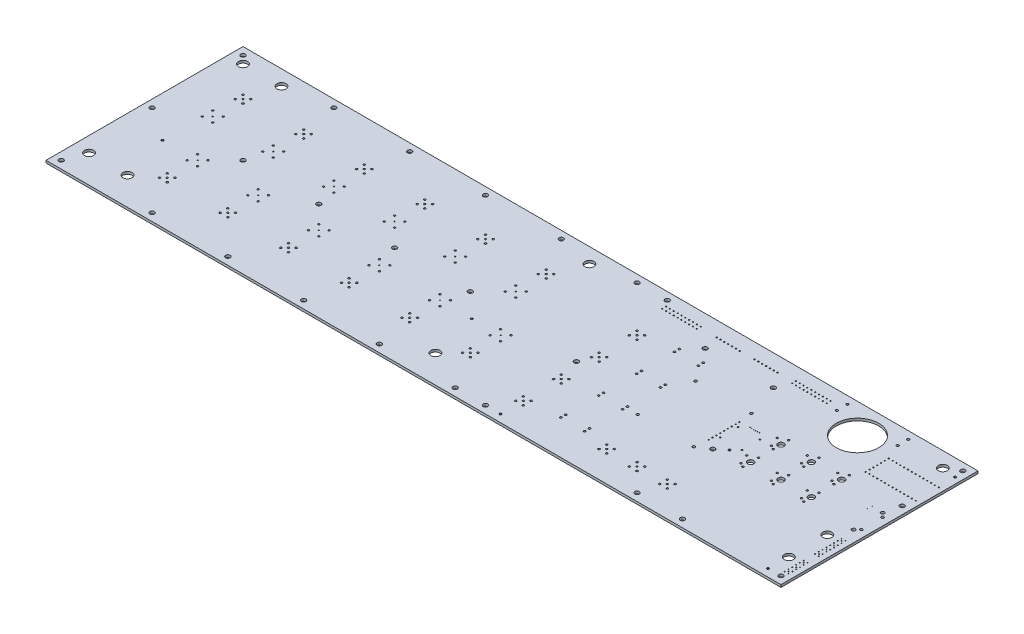
from build123d import *

# Parameters (mm, degrees)
SKETCH3_W           = 485
SKETCH3_H           = 130
SKETCH3_R           = 14
SKETCH3_R_2         = 1.5
SKETCH3_R_3         = 3
SKETCH3_R_4         = 0.3
SKETCH3_R_5         = 0.59055
SKETCH3_R_6         = 0.638175
SKETCH3_R_7         = 0.3375
SKETCH3_R_8         = 0.6
SKETCH3_R_9         = 0.8
SKETCH3_R_10        = 0.9
SKETCH3_R_11        = 1.15
SKETCH3_R_12        = 0.69375
SKETCH3_R_13        = 2.0002
SKETCH3_R_14        = 0.6429
SKETCH3_R_15        = 0.635
SKETCH3_R_16        = 0.225
SKETCH3_R_17        = 0.45
SKETCH3_R_18        = 0.36195
SKETCH3_R_19        = 0.381
SKETCH3_R_20        = 0.879
BOSS_EXTRUDE1_DEPTH = 1.6


with BuildPart() as part:
    # Sketch3 → Boss-Extrude1 (new body)
    with BuildSketch(Plane(origin=(0, 0, 0), x_dir=(1, 0, 0), z_dir=(0, 1, 0))):
        with Locations((62.5, 5)):
            Rectangle(SKETCH3_W, SKETCH3_H)
        with Locations((245, 50.5)):
            Circle(SKETCH3_R, mode=Mode.SUBTRACT)
        with Locations((-175, 65)):
            Circle(SKETCH3_R_2, mode=Mode.SUBTRACT)
        with Locations((-175, -55)):
            Circle(SKETCH3_R_2, mode=Mode.SUBTRACT)
        with Locations((300, 65)):
            Circle(SKETCH3_R_2, mode=Mode.SUBTRACT)
        with Locations((300, -55)):
            Circle(SKETCH3_R_2, mode=Mode.SUBTRACT)
        with Locations((85, 65)):
            Circle(SKETCH3_R_2, mode=Mode.SUBTRACT)
        with Locations((105, 65)):
            Circle(SKETCH3_R_2, mode=Mode.SUBTRACT)
        with Locations((105, -55)):
            Circle(SKETCH3_R_2, mode=Mode.SUBTRACT)
        with Locations((85, -55)):
            Circle(SKETCH3_R_2, mode=Mode.SUBTRACT)
        with Locations((35, -55)):
            Circle(SKETCH3_R_2, mode=Mode.SUBTRACT)
        with Locations((-15, -55)):
            Circle(SKETCH3_R_2, mode=Mode.SUBTRACT)
        with Locations((-65, -55)):
            Circle(SKETCH3_R_2, mode=Mode.SUBTRACT)
        with Locations((-115, -55)):
            Circle(SKETCH3_R_2, mode=Mode.SUBTRACT)
        with Locations((-115, 65)):
            Circle(SKETCH3_R_2, mode=Mode.SUBTRACT)
        with Locations((-65, 65)):
            Circle(SKETCH3_R_2, mode=Mode.SUBTRACT)
        with Locations((-15, 65)):
            Circle(SKETCH3_R_2, mode=Mode.SUBTRACT)
        with Locations((35, 65)):
            Circle(SKETCH3_R_2, mode=Mode.SUBTRACT)
        with Locations((-115, 5)):
            Circle(SKETCH3_R_2, mode=Mode.SUBTRACT)
        with Locations((-65, 5)):
            Circle(SKETCH3_R_2, mode=Mode.SUBTRACT)
        with Locations((-15, 5)):
            Circle(SKETCH3_R_2, mode=Mode.SUBTRACT)
        with Locations((35, 5)):
            Circle(SKETCH3_R_2, mode=Mode.SUBTRACT)
        with Locations((-175, 5)):
            Circle(SKETCH3_R_2, mode=Mode.SUBTRACT)
        with Locations((300, 25)):
            Circle(SKETCH3_R_2, mode=Mode.SUBTRACT)
        with Locations((110, 0)):
            Circle(SKETCH3_R_2, mode=Mode.SUBTRACT)
        with Locations((-170, 60)):
            Circle(SKETCH3_R_3, mode=Mode.SUBTRACT)
        with Locations((58.6, 60)):
            Circle(SKETCH3_R_3, mode=Mode.SUBTRACT)
        with Locations((58.6, -41.6)):
            Circle(SKETCH3_R_3, mode=Mode.SUBTRACT)
        with Locations((-170, -41.6)):
            Circle(SKETCH3_R_3, mode=Mode.SUBTRACT)
        with Locations((291.8, -41.6)):
            Circle(SKETCH3_R_3, mode=Mode.SUBTRACT)
        with Locations((-144.6, 60)):
            Circle(SKETCH3_R_3, mode=Mode.SUBTRACT)
        with Locations((-144.6, -41.6)):
            Circle(SKETCH3_R_3, mode=Mode.SUBTRACT)
        with Locations((291.8, -16.2)):
            Circle(SKETCH3_R_3, mode=Mode.SUBTRACT)
        with Locations((291.8, 60)):
            Circle(SKETCH3_R_3, mode=Mode.SUBTRACT)
        with Locations((145, 50)):
            Circle(SKETCH3_R_2, mode=Mode.SUBTRACT)
        with Locations((205, -55)):
            Circle(SKETCH3_R_2, mode=Mode.SUBTRACT)
        with Locations((190, 50)):
            Circle(SKETCH3_R_2, mode=Mode.SUBTRACT)
        with Locations((235, -55)):
            Circle(SKETCH3_R_2, mode=Mode.SUBTRACT)
        with Locations((205, -5)):
            Circle(SKETCH3_R_2, mode=Mode.SUBTRACT)
        with Locations((298.73, -38.73)):
            Circle(SKETCH3_R_4, mode=Mode.SUBTRACT)
        with Locations((298.73, -41.27)):
            Circle(SKETCH3_R_4, mode=Mode.SUBTRACT)
        with Locations((301.27, -41.27)):
            Circle(SKETCH3_R_4, mode=Mode.SUBTRACT)
        with Locations((301.27, -38.73)):
            Circle(SKETCH3_R_4, mode=Mode.SUBTRACT)
        with Locations((300, -40)):
            Circle(SKETCH3_R_4, mode=Mode.SUBTRACT)
        with Locations((210, -40)):
            Circle(SKETCH3_R_5, mode=Mode.SUBTRACT)
        with Locations((207.46, -37.46)):
            Circle(SKETCH3_R_6, mode=Mode.SUBTRACT)
        with Locations((212.54, -37.46)):
            Circle(SKETCH3_R_6, mode=Mode.SUBTRACT)
        with Locations((207.46, -42.54)):
            Circle(SKETCH3_R_6, mode=Mode.SUBTRACT)
        with Locations((212.54, -42.54)):
            Circle(SKETCH3_R_6, mode=Mode.SUBTRACT)
        with Locations((298.73, -43.73)):
            Circle(SKETCH3_R_4, mode=Mode.SUBTRACT)
        with Locations((298.73, -46.27)):
            Circle(SKETCH3_R_4, mode=Mode.SUBTRACT)
        with Locations((301.27, -46.27)):
            Circle(SKETCH3_R_4, mode=Mode.SUBTRACT)
        with Locations((301.27, -43.73)):
            Circle(SKETCH3_R_4, mode=Mode.SUBTRACT)
        with Locations((300, -45)):
            Circle(SKETCH3_R_4, mode=Mode.SUBTRACT)
        with Locations((190, -40)):
            Circle(SKETCH3_R_5, mode=Mode.SUBTRACT)
        with Locations((187.46, -37.46)):
            Circle(SKETCH3_R_6, mode=Mode.SUBTRACT)
        with Locations((192.54, -37.46)):
            Circle(SKETCH3_R_6, mode=Mode.SUBTRACT)
        with Locations((187.46, -42.54)):
            Circle(SKETCH3_R_6, mode=Mode.SUBTRACT)
        with Locations((192.54, -42.54)):
            Circle(SKETCH3_R_6, mode=Mode.SUBTRACT)
        with Locations((115, -40)):
            Circle(SKETCH3_R_5, mode=Mode.SUBTRACT)
        with Locations((112.46, -37.46)):
            Circle(SKETCH3_R_6, mode=Mode.SUBTRACT)
        with Locations((117.54, -37.46)):
            Circle(SKETCH3_R_6, mode=Mode.SUBTRACT)
        with Locations((112.46, -42.54)):
            Circle(SKETCH3_R_6, mode=Mode.SUBTRACT)
        with Locations((117.54, -42.54)):
            Circle(SKETCH3_R_6, mode=Mode.SUBTRACT)
        with Locations((115, -15)):
            Circle(SKETCH3_R_5, mode=Mode.SUBTRACT)
        with Locations((112.46, -12.46)):
            Circle(SKETCH3_R_6, mode=Mode.SUBTRACT)
        with Locations((117.54, -12.46)):
            Circle(SKETCH3_R_6, mode=Mode.SUBTRACT)
        with Locations((112.46, -17.54)):
            Circle(SKETCH3_R_6, mode=Mode.SUBTRACT)
        with Locations((117.54, -17.54)):
            Circle(SKETCH3_R_6, mode=Mode.SUBTRACT)
        with Locations((115, 10)):
            Circle(SKETCH3_R_5, mode=Mode.SUBTRACT)
        with Locations((112.46, 12.54)):
            Circle(SKETCH3_R_6, mode=Mode.SUBTRACT)
        with Locations((117.54, 12.54)):
            Circle(SKETCH3_R_6, mode=Mode.SUBTRACT)
        with Locations((112.46, 7.46)):
            Circle(SKETCH3_R_6, mode=Mode.SUBTRACT)
        with Locations((117.54, 7.46)):
            Circle(SKETCH3_R_6, mode=Mode.SUBTRACT)
        with Locations((115, 35)):
            Circle(SKETCH3_R_5, mode=Mode.SUBTRACT)
        with Locations((112.46, 37.54)):
            Circle(SKETCH3_R_6, mode=Mode.SUBTRACT)
        with Locations((117.54, 37.54)):
            Circle(SKETCH3_R_6, mode=Mode.SUBTRACT)
        with Locations((112.46, 32.46)):
            Circle(SKETCH3_R_6, mode=Mode.SUBTRACT)
        with Locations((117.54, 32.46)):
            Circle(SKETCH3_R_6, mode=Mode.SUBTRACT)
        with Locations((298.73, -28.73)):
            Circle(SKETCH3_R_4, mode=Mode.SUBTRACT)
        with Locations((298.73, -31.27)):
            Circle(SKETCH3_R_4, mode=Mode.SUBTRACT)
        with Locations((301.27, -31.27)):
            Circle(SKETCH3_R_4, mode=Mode.SUBTRACT)
        with Locations((301.27, -28.73)):
            Circle(SKETCH3_R_4, mode=Mode.SUBTRACT)
        with Locations((300, -30)):
            Circle(SKETCH3_R_4, mode=Mode.SUBTRACT)
        with Locations((298.73, -23.73)):
            Circle(SKETCH3_R_4, mode=Mode.SUBTRACT)
        with Locations((298.73, -26.27)):
            Circle(SKETCH3_R_4, mode=Mode.SUBTRACT)
        with Locations((301.27, -26.27)):
            Circle(SKETCH3_R_4, mode=Mode.SUBTRACT)
        with Locations((301.27, -23.73)):
            Circle(SKETCH3_R_4, mode=Mode.SUBTRACT)
        with Locations((300, -25)):
            Circle(SKETCH3_R_4, mode=Mode.SUBTRACT)
        with Locations((298.73, -18.73)):
            Circle(SKETCH3_R_4, mode=Mode.SUBTRACT)
        with Locations((298.73, -21.27)):
            Circle(SKETCH3_R_4, mode=Mode.SUBTRACT)
        with Locations((301.27, -21.27)):
            Circle(SKETCH3_R_4, mode=Mode.SUBTRACT)
        with Locations((301.27, -18.73)):
            Circle(SKETCH3_R_4, mode=Mode.SUBTRACT)
        with Locations((300, -20)):
            Circle(SKETCH3_R_4, mode=Mode.SUBTRACT)
        with Locations((298.73, -13.73)):
            Circle(SKETCH3_R_4, mode=Mode.SUBTRACT)
        with Locations((298.73, -16.27)):
            Circle(SKETCH3_R_4, mode=Mode.SUBTRACT)
        with Locations((301.27, -16.27)):
            Circle(SKETCH3_R_4, mode=Mode.SUBTRACT)
        with Locations((301.27, -13.73)):
            Circle(SKETCH3_R_4, mode=Mode.SUBTRACT)
        with Locations((300, -15)):
            Circle(SKETCH3_R_4, mode=Mode.SUBTRACT)
        with Locations((298.73, -48.73)):
            Circle(SKETCH3_R_4, mode=Mode.SUBTRACT)
        with Locations((298.73, -51.27)):
            Circle(SKETCH3_R_4, mode=Mode.SUBTRACT)
        with Locations((301.27, -51.27)):
            Circle(SKETCH3_R_4, mode=Mode.SUBTRACT)
        with Locations((301.27, -48.73)):
            Circle(SKETCH3_R_4, mode=Mode.SUBTRACT)
        with Locations((300, -50)):
            Circle(SKETCH3_R_4, mode=Mode.SUBTRACT)
        with Locations((170, -40)):
            Circle(SKETCH3_R_5, mode=Mode.SUBTRACT)
        with Locations((167.46, -37.46)):
            Circle(SKETCH3_R_6, mode=Mode.SUBTRACT)
        with Locations((172.54, -37.46)):
            Circle(SKETCH3_R_6, mode=Mode.SUBTRACT)
        with Locations((167.46, -42.54)):
            Circle(SKETCH3_R_6, mode=Mode.SUBTRACT)
        with Locations((172.54, -42.54)):
            Circle(SKETCH3_R_6, mode=Mode.SUBTRACT)
        with Locations((-150, 20)):
            Circle(SKETCH3_R_7, mode=Mode.SUBTRACT)
        with Locations((-146.57, 23.43)):
            Circle(SKETCH3_R_8, mode=Mode.SUBTRACT)
        with Locations((-153.43, 23.43)):
            Circle(SKETCH3_R_8, mode=Mode.SUBTRACT)
        with Locations((-153.43, 16.57)):
            Circle(SKETCH3_R_8, mode=Mode.SUBTRACT)
        with Locations((-146.57, 16.57)):
            Circle(SKETCH3_R_8, mode=Mode.SUBTRACT)
        with Locations((-130, -10)):
            Circle(SKETCH3_R_7, mode=Mode.SUBTRACT)
        with Locations((-126.57, -6.57)):
            Circle(SKETCH3_R_8, mode=Mode.SUBTRACT)
        with Locations((-133.43, -6.57)):
            Circle(SKETCH3_R_8, mode=Mode.SUBTRACT)
        with Locations((-133.43, -13.43)):
            Circle(SKETCH3_R_8, mode=Mode.SUBTRACT)
        with Locations((-126.57, -13.43)):
            Circle(SKETCH3_R_8, mode=Mode.SUBTRACT)
        with Locations((-110, 20)):
            Circle(SKETCH3_R_7, mode=Mode.SUBTRACT)
        with Locations((-106.57, 23.43)):
            Circle(SKETCH3_R_8, mode=Mode.SUBTRACT)
        with Locations((-113.43, 23.43)):
            Circle(SKETCH3_R_8, mode=Mode.SUBTRACT)
        with Locations((-113.43, 16.57)):
            Circle(SKETCH3_R_8, mode=Mode.SUBTRACT)
        with Locations((-106.57, 16.57)):
            Circle(SKETCH3_R_8, mode=Mode.SUBTRACT)
        with Locations((-90, -10)):
            Circle(SKETCH3_R_7, mode=Mode.SUBTRACT)
        with Locations((-86.57, -6.57)):
            Circle(SKETCH3_R_8, mode=Mode.SUBTRACT)
        with Locations((-93.43, -6.57)):
            Circle(SKETCH3_R_8, mode=Mode.SUBTRACT)
        with Locations((-93.43, -13.43)):
            Circle(SKETCH3_R_8, mode=Mode.SUBTRACT)
        with Locations((-86.57, -13.43)):
            Circle(SKETCH3_R_8, mode=Mode.SUBTRACT)
        with Locations((-70, 20)):
            Circle(SKETCH3_R_7, mode=Mode.SUBTRACT)
        with Locations((-66.57, 23.43)):
            Circle(SKETCH3_R_8, mode=Mode.SUBTRACT)
        with Locations((-73.43, 23.43)):
            Circle(SKETCH3_R_8, mode=Mode.SUBTRACT)
        with Locations((-73.43, 16.57)):
            Circle(SKETCH3_R_8, mode=Mode.SUBTRACT)
        with Locations((-66.57, 16.57)):
            Circle(SKETCH3_R_8, mode=Mode.SUBTRACT)
        with Locations((-50, -10)):
            Circle(SKETCH3_R_7, mode=Mode.SUBTRACT)
        with Locations((-46.57, -6.57)):
            Circle(SKETCH3_R_8, mode=Mode.SUBTRACT)
        with Locations((-53.43, -6.57)):
            Circle(SKETCH3_R_8, mode=Mode.SUBTRACT)
        with Locations((-53.43, -13.43)):
            Circle(SKETCH3_R_8, mode=Mode.SUBTRACT)
        with Locations((-46.57, -13.43)):
            Circle(SKETCH3_R_8, mode=Mode.SUBTRACT)
        with Locations((-150, 40)):
            Circle(SKETCH3_R_5, mode=Mode.SUBTRACT)
        with Locations((-152.54, 42.54)):
            Circle(SKETCH3_R_6, mode=Mode.SUBTRACT)
        with Locations((-147.46, 42.54)):
            Circle(SKETCH3_R_6, mode=Mode.SUBTRACT)
        with Locations((-152.54, 37.46)):
            Circle(SKETCH3_R_6, mode=Mode.SUBTRACT)
        with Locations((-147.46, 37.46)):
            Circle(SKETCH3_R_6, mode=Mode.SUBTRACT)
        with Locations((-130, -30)):
            Circle(SKETCH3_R_5, mode=Mode.SUBTRACT)
        with Locations((-132.54, -27.46)):
            Circle(SKETCH3_R_6, mode=Mode.SUBTRACT)
        with Locations((-127.46, -27.46)):
            Circle(SKETCH3_R_6, mode=Mode.SUBTRACT)
        with Locations((-132.54, -32.54)):
            Circle(SKETCH3_R_6, mode=Mode.SUBTRACT)
        with Locations((-127.46, -32.54)):
            Circle(SKETCH3_R_6, mode=Mode.SUBTRACT)
        with Locations((-110, 40)):
            Circle(SKETCH3_R_5, mode=Mode.SUBTRACT)
        with Locations((-112.54, 42.54)):
            Circle(SKETCH3_R_6, mode=Mode.SUBTRACT)
        with Locations((-107.46, 42.54)):
            Circle(SKETCH3_R_6, mode=Mode.SUBTRACT)
        with Locations((-112.54, 37.46)):
            Circle(SKETCH3_R_6, mode=Mode.SUBTRACT)
        with Locations((-107.46, 37.46)):
            Circle(SKETCH3_R_6, mode=Mode.SUBTRACT)
        with Locations((-90, -30)):
            Circle(SKETCH3_R_5, mode=Mode.SUBTRACT)
        with Locations((-92.54, -27.46)):
            Circle(SKETCH3_R_6, mode=Mode.SUBTRACT)
        with Locations((-87.46, -27.46)):
            Circle(SKETCH3_R_6, mode=Mode.SUBTRACT)
        with Locations((-92.54, -32.54)):
            Circle(SKETCH3_R_6, mode=Mode.SUBTRACT)
        with Locations((-87.46, -32.54)):
            Circle(SKETCH3_R_6, mode=Mode.SUBTRACT)
        with Locations((-70, 40)):
            Circle(SKETCH3_R_5, mode=Mode.SUBTRACT)
        with Locations((-72.54, 42.54)):
            Circle(SKETCH3_R_6, mode=Mode.SUBTRACT)
        with Locations((-67.46, 42.54)):
            Circle(SKETCH3_R_6, mode=Mode.SUBTRACT)
        with Locations((-72.54, 37.46)):
            Circle(SKETCH3_R_6, mode=Mode.SUBTRACT)
        with Locations((-67.46, 37.46)):
            Circle(SKETCH3_R_6, mode=Mode.SUBTRACT)
        with Locations((-50, -30)):
            Circle(SKETCH3_R_5, mode=Mode.SUBTRACT)
        with Locations((-52.54, -27.46)):
            Circle(SKETCH3_R_6, mode=Mode.SUBTRACT)
        with Locations((-47.46, -27.46)):
            Circle(SKETCH3_R_6, mode=Mode.SUBTRACT)
        with Locations((-52.54, -32.54)):
            Circle(SKETCH3_R_6, mode=Mode.SUBTRACT)
        with Locations((-47.46, -32.54)):
            Circle(SKETCH3_R_6, mode=Mode.SUBTRACT)
        with Locations((-30, 20)):
            Circle(SKETCH3_R_7, mode=Mode.SUBTRACT)
        with Locations((-26.57, 23.43)):
            Circle(SKETCH3_R_8, mode=Mode.SUBTRACT)
        with Locations((-33.43, 23.43)):
            Circle(SKETCH3_R_8, mode=Mode.SUBTRACT)
        with Locations((-33.43, 16.57)):
            Circle(SKETCH3_R_8, mode=Mode.SUBTRACT)
        with Locations((-26.57, 16.57)):
            Circle(SKETCH3_R_8, mode=Mode.SUBTRACT)
        with Locations((-10, -10)):
            Circle(SKETCH3_R_7, mode=Mode.SUBTRACT)
        with Locations((-6.57, -6.57)):
            Circle(SKETCH3_R_8, mode=Mode.SUBTRACT)
        with Locations((-13.43, -6.57)):
            Circle(SKETCH3_R_8, mode=Mode.SUBTRACT)
        with Locations((-13.43, -13.43)):
            Circle(SKETCH3_R_8, mode=Mode.SUBTRACT)
        with Locations((-6.57, -13.43)):
            Circle(SKETCH3_R_8, mode=Mode.SUBTRACT)
        with Locations((10, 20)):
            Circle(SKETCH3_R_7, mode=Mode.SUBTRACT)
        with Locations((13.43, 23.43)):
            Circle(SKETCH3_R_8, mode=Mode.SUBTRACT)
        with Locations((6.57, 23.43)):
            Circle(SKETCH3_R_8, mode=Mode.SUBTRACT)
        with Locations((6.57, 16.57)):
            Circle(SKETCH3_R_8, mode=Mode.SUBTRACT)
        with Locations((13.43, 16.57)):
            Circle(SKETCH3_R_8, mode=Mode.SUBTRACT)
        with Locations((30, -10)):
            Circle(SKETCH3_R_7, mode=Mode.SUBTRACT)
        with Locations((33.43, -6.57)):
            Circle(SKETCH3_R_8, mode=Mode.SUBTRACT)
        with Locations((26.57, -6.57)):
            Circle(SKETCH3_R_8, mode=Mode.SUBTRACT)
        with Locations((26.57, -13.43)):
            Circle(SKETCH3_R_8, mode=Mode.SUBTRACT)
        with Locations((33.43, -13.43)):
            Circle(SKETCH3_R_8, mode=Mode.SUBTRACT)
        with Locations((50, 20)):
            Circle(SKETCH3_R_7, mode=Mode.SUBTRACT)
        with Locations((53.43, 23.43)):
            Circle(SKETCH3_R_8, mode=Mode.SUBTRACT)
        with Locations((46.57, 23.43)):
            Circle(SKETCH3_R_8, mode=Mode.SUBTRACT)
        with Locations((46.57, 16.57)):
            Circle(SKETCH3_R_8, mode=Mode.SUBTRACT)
        with Locations((53.43, 16.57)):
            Circle(SKETCH3_R_8, mode=Mode.SUBTRACT)
        with Locations((70, -10)):
            Circle(SKETCH3_R_7, mode=Mode.SUBTRACT)
        with Locations((73.43, -6.57)):
            Circle(SKETCH3_R_8, mode=Mode.SUBTRACT)
        with Locations((66.57, -6.57)):
            Circle(SKETCH3_R_8, mode=Mode.SUBTRACT)
        with Locations((66.57, -13.43)):
            Circle(SKETCH3_R_8, mode=Mode.SUBTRACT)
        with Locations((73.43, -13.43)):
            Circle(SKETCH3_R_8, mode=Mode.SUBTRACT)
        with Locations((-30, 40)):
            Circle(SKETCH3_R_5, mode=Mode.SUBTRACT)
        with Locations((-32.54, 42.54)):
            Circle(SKETCH3_R_6, mode=Mode.SUBTRACT)
        with Locations((-27.46, 42.54)):
            Circle(SKETCH3_R_6, mode=Mode.SUBTRACT)
        with Locations((-32.54, 37.46)):
            Circle(SKETCH3_R_6, mode=Mode.SUBTRACT)
        with Locations((-27.46, 37.46)):
            Circle(SKETCH3_R_6, mode=Mode.SUBTRACT)
        with Locations((-10, -30)):
            Circle(SKETCH3_R_5, mode=Mode.SUBTRACT)
        with Locations((-12.54, -27.46)):
            Circle(SKETCH3_R_6, mode=Mode.SUBTRACT)
        with Locations((-7.46, -27.46)):
            Circle(SKETCH3_R_6, mode=Mode.SUBTRACT)
        with Locations((-12.54, -32.54)):
            Circle(SKETCH3_R_6, mode=Mode.SUBTRACT)
        with Locations((-7.46, -32.54)):
            Circle(SKETCH3_R_6, mode=Mode.SUBTRACT)
        with Locations((10, 40)):
            Circle(SKETCH3_R_5, mode=Mode.SUBTRACT)
        with Locations((7.46, 42.54)):
            Circle(SKETCH3_R_6, mode=Mode.SUBTRACT)
        with Locations((12.54, 42.54)):
            Circle(SKETCH3_R_6, mode=Mode.SUBTRACT)
        with Locations((7.46, 37.46)):
            Circle(SKETCH3_R_6, mode=Mode.SUBTRACT)
        with Locations((12.54, 37.46)):
            Circle(SKETCH3_R_6, mode=Mode.SUBTRACT)
        with Locations((30, -30)):
            Circle(SKETCH3_R_5, mode=Mode.SUBTRACT)
        with Locations((27.46, -27.46)):
            Circle(SKETCH3_R_6, mode=Mode.SUBTRACT)
        with Locations((32.54, -27.46)):
            Circle(SKETCH3_R_6, mode=Mode.SUBTRACT)
        with Locations((27.46, -32.54)):
            Circle(SKETCH3_R_6, mode=Mode.SUBTRACT)
        with Locations((32.54, -32.54)):
            Circle(SKETCH3_R_6, mode=Mode.SUBTRACT)
        with Locations((50, 40)):
            Circle(SKETCH3_R_5, mode=Mode.SUBTRACT)
        with Locations((47.46, 42.54)):
            Circle(SKETCH3_R_6, mode=Mode.SUBTRACT)
        with Locations((52.54, 42.54)):
            Circle(SKETCH3_R_6, mode=Mode.SUBTRACT)
        with Locations((47.46, 37.46)):
            Circle(SKETCH3_R_6, mode=Mode.SUBTRACT)
        with Locations((52.54, 37.46)):
            Circle(SKETCH3_R_6, mode=Mode.SUBTRACT)
        with Locations((70, -30)):
            Circle(SKETCH3_R_5, mode=Mode.SUBTRACT)
        with Locations((67.46, -27.46)):
            Circle(SKETCH3_R_6, mode=Mode.SUBTRACT)
        with Locations((72.54, -27.46)):
            Circle(SKETCH3_R_6, mode=Mode.SUBTRACT)
        with Locations((67.46, -32.54)):
            Circle(SKETCH3_R_6, mode=Mode.SUBTRACT)
        with Locations((72.54, -32.54)):
            Circle(SKETCH3_R_6, mode=Mode.SUBTRACT)
        with Locations((223.9, 65)):
            Circle(SKETCH3_R_9, mode=Mode.SUBTRACT)
        with Locations((223.9, 58)):
            Circle(SKETCH3_R_9, mode=Mode.SUBTRACT)
        with Locations((264, 65)):
            Circle(SKETCH3_R_9, mode=Mode.SUBTRACT)
        with Locations((264, 58)):
            Circle(SKETCH3_R_9, mode=Mode.SUBTRACT)
        with Locations((300, 12)):
            Circle(SKETCH3_R_10, mode=Mode.SUBTRACT)
        with Locations((300, -2)):
            Circle(SKETCH3_R_10, mode=Mode.SUBTRACT)
        with Locations((297.5, 14.6)):
            Circle(SKETCH3_R_11, mode=Mode.SUBTRACT)
        with Locations((297.5, -4.6)):
            Circle(SKETCH3_R_11, mode=Mode.SUBTRACT)
        with Locations((152.575, -33.91)):
            Circle(SKETCH3_R_12, mode=Mode.SUBTRACT)
        with Locations((152.575, -37.09)):
            Circle(SKETCH3_R_12, mode=Mode.SUBTRACT)
        with Locations((136.825, -33.91)):
            Circle(SKETCH3_R_12, mode=Mode.SUBTRACT)
        with Locations((136.825, -37.09)):
            Circle(SKETCH3_R_12, mode=Mode.SUBTRACT)
        with Locations((152.575, -8.91)):
            Circle(SKETCH3_R_12, mode=Mode.SUBTRACT)
        with Locations((152.575, -12.09)):
            Circle(SKETCH3_R_12, mode=Mode.SUBTRACT)
        with Locations((136.825, -8.91)):
            Circle(SKETCH3_R_12, mode=Mode.SUBTRACT)
        with Locations((136.825, -12.09)):
            Circle(SKETCH3_R_12, mode=Mode.SUBTRACT)
        with Locations((152.575, 16.09)):
            Circle(SKETCH3_R_12, mode=Mode.SUBTRACT)
        with Locations((152.575, 12.91)):
            Circle(SKETCH3_R_12, mode=Mode.SUBTRACT)
        with Locations((136.825, 16.09)):
            Circle(SKETCH3_R_12, mode=Mode.SUBTRACT)
        with Locations((136.825, 12.91)):
            Circle(SKETCH3_R_12, mode=Mode.SUBTRACT)
        with Locations((152.575, 41.09)):
            Circle(SKETCH3_R_12, mode=Mode.SUBTRACT)
        with Locations((152.575, 37.91)):
            Circle(SKETCH3_R_12, mode=Mode.SUBTRACT)
        with Locations((136.825, 41.09)):
            Circle(SKETCH3_R_12, mode=Mode.SUBTRACT)
        with Locations((136.825, 37.91)):
            Circle(SKETCH3_R_12, mode=Mode.SUBTRACT)
        with Locations((225, 0)):
            Circle(SKETCH3_R_13, mode=Mode.SUBTRACT)
        with Locations((225, -5.08)):
            Circle(SKETCH3_R_14, mode=Mode.SUBTRACT)
        with Locations((225, 5.08)):
            Circle(SKETCH3_R_14, mode=Mode.SUBTRACT)
        with Locations((222.46, -3.81)):
            Circle(SKETCH3_R_15, mode=Mode.SUBTRACT)
        with Locations((219.92, 2.54)):
            Circle(SKETCH3_R_15, mode=Mode.SUBTRACT)
        with Locations((225, 20)):
            Circle(SKETCH3_R_13, mode=Mode.SUBTRACT)
        with Locations((225, 14.92)):
            Circle(SKETCH3_R_14, mode=Mode.SUBTRACT)
        with Locations((225, 25.08)):
            Circle(SKETCH3_R_14, mode=Mode.SUBTRACT)
        with Locations((222.46, 16.19)):
            Circle(SKETCH3_R_15, mode=Mode.SUBTRACT)
        with Locations((219.92, 22.54)):
            Circle(SKETCH3_R_15, mode=Mode.SUBTRACT)
        with Locations((245, 0)):
            Circle(SKETCH3_R_13, mode=Mode.SUBTRACT)
        with Locations((245, -5.08)):
            Circle(SKETCH3_R_14, mode=Mode.SUBTRACT)
        with Locations((245, 5.08)):
            Circle(SKETCH3_R_14, mode=Mode.SUBTRACT)
        with Locations((242.46, -3.81)):
            Circle(SKETCH3_R_15, mode=Mode.SUBTRACT)
        with Locations((239.92, 2.54)):
            Circle(SKETCH3_R_15, mode=Mode.SUBTRACT)
        with Locations((245, 20)):
            Circle(SKETCH3_R_13, mode=Mode.SUBTRACT)
        with Locations((245, 14.92)):
            Circle(SKETCH3_R_14, mode=Mode.SUBTRACT)
        with Locations((245, 25.08)):
            Circle(SKETCH3_R_14, mode=Mode.SUBTRACT)
        with Locations((242.46, 16.19)):
            Circle(SKETCH3_R_15, mode=Mode.SUBTRACT)
        with Locations((239.92, 22.54)):
            Circle(SKETCH3_R_15, mode=Mode.SUBTRACT)
        with Locations((204.825, 19.6)):
            Circle(SKETCH3_R_16, mode=Mode.SUBTRACT)
        with Locations((206.095, 19.6)):
            Circle(SKETCH3_R_16, mode=Mode.SUBTRACT)
        with Locations((207.365, 19.6)):
            Circle(SKETCH3_R_16, mode=Mode.SUBTRACT)
        with Locations((208.635, 19.6)):
            Circle(SKETCH3_R_16, mode=Mode.SUBTRACT)
        with Locations((209.905, 19.6)):
            Circle(SKETCH3_R_16, mode=Mode.SUBTRACT)
        with Locations((211.175, 19.6)):
            Circle(SKETCH3_R_16, mode=Mode.SUBTRACT)
        with Locations((215.15, 15.9)):
            Circle(SKETCH3_R_17, mode=Mode.SUBTRACT)
        with Locations((215.15, 4.1)):
            Circle(SKETCH3_R_17, mode=Mode.SUBTRACT)
        with Locations((200.85, 4.1)):
            Circle(SKETCH3_R_17, mode=Mode.SUBTRACT)
        with Locations((200.85, 15.9)):
            Circle(SKETCH3_R_17, mode=Mode.SUBTRACT)
        with Locations((265, 0)):
            Circle(SKETCH3_R_13, mode=Mode.SUBTRACT)
        with Locations((265, -5.08)):
            Circle(SKETCH3_R_14, mode=Mode.SUBTRACT)
        with Locations((265, 5.08)):
            Circle(SKETCH3_R_14, mode=Mode.SUBTRACT)
        with Locations((262.46, -3.81)):
            Circle(SKETCH3_R_15, mode=Mode.SUBTRACT)
        with Locations((259.92, 2.54)):
            Circle(SKETCH3_R_15, mode=Mode.SUBTRACT)
        with Locations((265, 20)):
            Circle(SKETCH3_R_13, mode=Mode.SUBTRACT)
        with Locations((265, 14.92)):
            Circle(SKETCH3_R_14, mode=Mode.SUBTRACT)
        with Locations((265, 25.08)):
            Circle(SKETCH3_R_14, mode=Mode.SUBTRACT)
        with Locations((262.46, 16.19)):
            Circle(SKETCH3_R_15, mode=Mode.SUBTRACT)
        with Locations((259.92, 22.54)):
            Circle(SKETCH3_R_15, mode=Mode.SUBTRACT)
        with Locations((298.97, 47.62)):
            Circle(SKETCH3_R_18, mode=Mode.SUBTRACT)
        with Locations((296.43, 47.62)):
            Circle(SKETCH3_R_18, mode=Mode.SUBTRACT)
        with Locations((293.89, 47.62)):
            Circle(SKETCH3_R_18, mode=Mode.SUBTRACT)
        with Locations((291.35, 47.62)):
            Circle(SKETCH3_R_18, mode=Mode.SUBTRACT)
        with Locations((296.43, 32.38)):
            Circle(SKETCH3_R_18, mode=Mode.SUBTRACT)
        with Locations((268.49, 42.54)):
            Circle(SKETCH3_R_18, mode=Mode.SUBTRACT)
        with Locations((288.81, 47.62)):
            Circle(SKETCH3_R_18, mode=Mode.SUBTRACT)
        with Locations((286.27, 47.62)):
            Circle(SKETCH3_R_18, mode=Mode.SUBTRACT)
        with Locations((283.73, 47.62)):
            Circle(SKETCH3_R_18, mode=Mode.SUBTRACT)
        with Locations((281.19, 47.62)):
            Circle(SKETCH3_R_18, mode=Mode.SUBTRACT)
        with Locations((278.65, 47.62)):
            Circle(SKETCH3_R_18, mode=Mode.SUBTRACT)
        with Locations((276.11, 47.62)):
            Circle(SKETCH3_R_18, mode=Mode.SUBTRACT)
        with Locations((273.57, 47.62)):
            Circle(SKETCH3_R_18, mode=Mode.SUBTRACT)
        with Locations((271.03, 47.62)):
            Circle(SKETCH3_R_18, mode=Mode.SUBTRACT)
        with Locations((268.49, 47.62)):
            Circle(SKETCH3_R_18, mode=Mode.SUBTRACT)
        with Locations((268.49, 32.38)):
            Circle(SKETCH3_R_18, mode=Mode.SUBTRACT)
        with Locations((271.03, 32.38)):
            Circle(SKETCH3_R_18, mode=Mode.SUBTRACT)
        with Locations((273.57, 32.38)):
            Circle(SKETCH3_R_18, mode=Mode.SUBTRACT)
        with Locations((276.11, 32.38)):
            Circle(SKETCH3_R_18, mode=Mode.SUBTRACT)
        with Locations((278.65, 32.38)):
            Circle(SKETCH3_R_18, mode=Mode.SUBTRACT)
        with Locations((281.19, 32.38)):
            Circle(SKETCH3_R_18, mode=Mode.SUBTRACT)
        with Locations((283.73, 32.38)):
            Circle(SKETCH3_R_18, mode=Mode.SUBTRACT)
        with Locations((286.27, 32.38)):
            Circle(SKETCH3_R_18, mode=Mode.SUBTRACT)
        with Locations((288.81, 32.38)):
            Circle(SKETCH3_R_18, mode=Mode.SUBTRACT)
        with Locations((291.35, 32.38)):
            Circle(SKETCH3_R_18, mode=Mode.SUBTRACT)
        with Locations((293.89, 32.38)):
            Circle(SKETCH3_R_18, mode=Mode.SUBTRACT)
        with Locations((268.49, 34.92)):
            Circle(SKETCH3_R_18, mode=Mode.SUBTRACT)
        with Locations((298.97, 32.38)):
            Circle(SKETCH3_R_18, mode=Mode.SUBTRACT)
        with Locations((301.51, 47.62)):
            Circle(SKETCH3_R_18, mode=Mode.SUBTRACT)
        with Locations((268.49, 40)):
            Circle(SKETCH3_R_18, mode=Mode.SUBTRACT)
        with Locations((268.49, 37.46)):
            Circle(SKETCH3_R_18, mode=Mode.SUBTRACT)
        with Locations((268.49, 45.08)):
            Circle(SKETCH3_R_18, mode=Mode.SUBTRACT)
        with Locations((301.51, 32.38)):
            Circle(SKETCH3_R_18, mode=Mode.SUBTRACT)
        with Locations((198.386, -1.11)):
            Circle(SKETCH3_R_19, mode=Mode.SUBTRACT)
        with Locations((198.386, 1.43)):
            Circle(SKETCH3_R_19, mode=Mode.SUBTRACT)
        with Locations((198.386, 3.97)):
            Circle(SKETCH3_R_19, mode=Mode.SUBTRACT)
        with Locations((198.386, 6.51)):
            Circle(SKETCH3_R_19, mode=Mode.SUBTRACT)
        with Locations((198.386, 9.05)):
            Circle(SKETCH3_R_19, mode=Mode.SUBTRACT)
        with Locations((198.386, 11.59)):
            Circle(SKETCH3_R_19, mode=Mode.SUBTRACT)
        with Locations((198.386, 14.13)):
            Circle(SKETCH3_R_19, mode=Mode.SUBTRACT)
        with Locations((198.386, 16.67)):
            Circle(SKETCH3_R_19, mode=Mode.SUBTRACT)
        with Locations((198.386, 19.21)):
            Circle(SKETCH3_R_19, mode=Mode.SUBTRACT)
        with Locations((160.54, -10)):
            Circle(SKETCH3_R_20, mode=Mode.SUBTRACT)
        with Locations((160.54, 28.1)):
            Circle(SKETCH3_R_20, mode=Mode.SUBTRACT)
        with Locations((197.37, -10)):
            Circle(SKETCH3_R_20, mode=Mode.SUBTRACT)
        with Locations((197.37, 28.1)):
            Circle(SKETCH3_R_20, mode=Mode.SUBTRACT)
        Polygon((142.1275, 59.82906), (142.1275, 60.17094), (142.36906, 60.4125), (142.71094, 60.4125), (142.9525, 60.17094), (142.9525, 59.82906), (142.71094, 59.5875), (142.36906, 59.5875), align=None, mode=Mode.SUBTRACT)
        Polygon((144.6675, 59.82906), (144.6675, 60.17094), (144.90906, 60.4125), (145.25094, 60.4125), (145.4925, 60.17094), (145.4925, 59.82906), (145.25094, 59.5875), (144.90906, 59.5875), align=None, mode=Mode.SUBTRACT)
        Polygon((147.2075, 59.82906), (147.2075, 60.17094), (147.44906, 60.4125), (147.79094, 60.4125), (148.0325, 60.17094), (148.0325, 59.82906), (147.79094, 59.5875), (147.44906, 59.5875), align=None, mode=Mode.SUBTRACT)
        Polygon((149.7475, 59.82906), (149.7475, 60.17094), (149.98906, 60.4125), (150.33094, 60.4125), (150.5725, 60.17094), (150.5725, 59.82906), (150.33094, 59.5875), (149.98906, 59.5875), align=None, mode=Mode.SUBTRACT)
        Polygon((152.2875, 59.82906), (152.2875, 60.17094), (152.52906, 60.4125), (152.87094, 60.4125), (153.1125, 60.17094), (153.1125, 59.82906), (152.87094, 59.5875), (152.52906, 59.5875), align=None, mode=Mode.SUBTRACT)
        Polygon((154.8275, 59.82906), (154.8275, 60.17094), (155.06906, 60.4125), (155.41094, 60.4125), (155.6525, 60.17094), (155.6525, 59.82906), (155.41094, 59.5875), (155.06906, 59.5875), align=None, mode=Mode.SUBTRACT)
        Polygon((157.3675, 59.82906), (157.3675, 60.17094), (157.60906, 60.4125), (157.95094, 60.4125), (158.1925, 60.17094), (158.1925, 59.82906), (157.95094, 59.5875), (157.60906, 59.5875), align=None, mode=Mode.SUBTRACT)
        Polygon((167.1275, 59.82906), (167.1275, 60.17094), (167.36906, 60.4125), (167.71094, 60.4125), (167.9525, 60.17094), (167.9525, 59.82906), (167.71094, 59.5875), (167.36906, 59.5875), align=None, mode=Mode.SUBTRACT)
        Polygon((169.6675, 59.82906), (169.6675, 60.17094), (169.90906, 60.4125), (170.25094, 60.4125), (170.4925, 60.17094), (170.4925, 59.82906), (170.25094, 59.5875), (169.90906, 59.5875), align=None, mode=Mode.SUBTRACT)
        Polygon((172.2075, 59.82906), (172.2075, 60.17094), (172.44906, 60.4125), (172.79094, 60.4125), (173.0325, 60.17094), (173.0325, 59.82906), (172.79094, 59.5875), (172.44906, 59.5875), align=None, mode=Mode.SUBTRACT)
        Polygon((174.7475, 59.82906), (174.7475, 60.17094), (174.98906, 60.4125), (175.33094, 60.4125), (175.5725, 60.17094), (175.5725, 59.82906), (175.33094, 59.5875), (174.98906, 59.5875), align=None, mode=Mode.SUBTRACT)
        Polygon((177.2875, 59.82906), (177.2875, 60.17094), (177.52906, 60.4125), (177.87094, 60.4125), (178.1125, 60.17094), (178.1125, 59.82906), (177.87094, 59.5875), (177.52906, 59.5875), align=None, mode=Mode.SUBTRACT)
        Polygon((179.8275, 59.82906), (179.8275, 60.17094), (180.06906, 60.4125), (180.41094, 60.4125), (180.6525, 60.17094), (180.6525, 59.82906), (180.41094, 59.5875), (180.06906, 59.5875), align=None, mode=Mode.SUBTRACT)
        Polygon((182.3675, 59.82906), (182.3675, 60.17094), (182.60906, 60.4125), (182.95094, 60.4125), (183.1925, 60.17094), (183.1925, 59.82906), (182.95094, 59.5875), (182.60906, 59.5875), align=None, mode=Mode.SUBTRACT)
        Polygon((131.3929, 58.56209776), (131.3929, 58.27790224), (131.19209776, 58.0771), (130.90790224, 58.0771), (130.7071, 58.27790224), (130.7071, 58.56209776), (130.90790224, 58.7629), (131.19209776, 58.7629), align=None, mode=Mode.SUBTRACT)
        Polygon((131.3929, 61.10209776), (131.3929, 60.81790224), (131.19209776, 60.6171), (130.90790224, 60.6171), (130.7071, 60.81790224), (130.7071, 61.10209776), (130.90790224, 61.3029), (131.19209776, 61.3029), align=None, mode=Mode.SUBTRACT)
        Polygon((128.8529, 58.56209776), (128.8529, 58.27790224), (128.65209776, 58.0771), (128.36790224, 58.0771), (128.1671, 58.27790224), (128.1671, 58.56209776), (128.36790224, 58.7629), (128.65209776, 58.7629), align=None, mode=Mode.SUBTRACT)
        Polygon((128.8529, 61.10209776), (128.8529, 60.81790224), (128.65209776, 60.6171), (128.36790224, 60.6171), (128.1671, 60.81790224), (128.1671, 61.10209776), (128.36790224, 61.3029), (128.65209776, 61.3029), align=None, mode=Mode.SUBTRACT)
        Polygon((126.3129, 58.56209776), (126.3129, 58.27790224), (126.11209776, 58.0771), (125.82790224, 58.0771), (125.6271, 58.27790224), (125.6271, 58.56209776), (125.82790224, 58.7629), (126.11209776, 58.7629), align=None, mode=Mode.SUBTRACT)
        Polygon((126.3129, 61.10209776), (126.3129, 60.81790224), (126.11209776, 60.6171), (125.82790224, 60.6171), (125.6271, 60.81790224), (125.6271, 61.10209776), (125.82790224, 61.3029), (126.11209776, 61.3029), align=None, mode=Mode.SUBTRACT)
        Polygon((123.7729, 58.56209776), (123.7729, 58.27790224), (123.57209776, 58.0771), (123.28790224, 58.0771), (123.0871, 58.27790224), (123.0871, 58.56209776), (123.28790224, 58.7629), (123.57209776, 58.7629), align=None, mode=Mode.SUBTRACT)
        Polygon((123.7729, 61.10209776), (123.7729, 60.81790224), (123.57209776, 60.6171), (123.28790224, 60.6171), (123.0871, 60.81790224), (123.0871, 61.10209776), (123.28790224, 61.3029), (123.57209776, 61.3029), align=None, mode=Mode.SUBTRACT)
        Polygon((121.2329, 58.56209776), (121.2329, 58.27790224), (121.03209776, 58.0771), (120.74790224, 58.0771), (120.5471, 58.27790224), (120.5471, 58.56209776), (120.74790224, 58.7629), (121.03209776, 58.7629), align=None, mode=Mode.SUBTRACT)
        Polygon((121.2329, 61.10209776), (121.2329, 60.81790224), (121.03209776, 60.6171), (120.74790224, 60.6171), (120.5471, 60.81790224), (120.5471, 61.10209776), (120.74790224, 61.3029), (121.03209776, 61.3029), align=None, mode=Mode.SUBTRACT)
        Polygon((118.6929, 58.56209776), (118.6929, 58.27790224), (118.49209776, 58.0771), (118.20790224, 58.0771), (118.0071, 58.27790224), (118.0071, 58.56209776), (118.20790224, 58.7629), (118.49209776, 58.7629), align=None, mode=Mode.SUBTRACT)
        Polygon((118.6929, 61.10209776), (118.6929, 60.81790224), (118.49209776, 60.6171), (118.20790224, 60.6171), (118.0071, 60.81790224), (118.0071, 61.10209776), (118.20790224, 61.3029), (118.49209776, 61.3029), align=None, mode=Mode.SUBTRACT)
        Polygon((116.1529, 58.56209776), (116.1529, 58.27790224), (115.95209776, 58.0771), (115.66790224, 58.0771), (115.4671, 58.27790224), (115.4671, 58.56209776), (115.66790224, 58.7629), (115.95209776, 58.7629), align=None, mode=Mode.SUBTRACT)
        Polygon((116.1529, 61.10209776), (116.1529, 60.81790224), (115.95209776, 60.6171), (115.66790224, 60.6171), (115.4671, 60.81790224), (115.4671, 61.10209776), (115.66790224, 61.3029), (115.95209776, 61.3029), align=None, mode=Mode.SUBTRACT)
        Polygon((113.6129, 58.56209776), (113.6129, 58.27790224), (113.41209776, 58.0771), (113.12790224, 58.0771), (112.9271, 58.27790224), (112.9271, 58.56209776), (113.12790224, 58.7629), (113.41209776, 58.7629), align=None, mode=Mode.SUBTRACT)
        Polygon((113.6129, 61.10209776), (113.6129, 60.81790224), (113.41209776, 60.6171), (113.12790224, 60.6171), (112.9271, 60.81790224), (112.9271, 61.10209776), (113.12790224, 61.3029), (113.41209776, 61.3029), align=None, mode=Mode.SUBTRACT)
        Polygon((111.0729, 58.56209776), (111.0729, 58.27790224), (110.87209776, 58.0771), (110.58790224, 58.0771), (110.3871, 58.27790224), (110.3871, 58.56209776), (110.58790224, 58.7629), (110.87209776, 58.7629), align=None, mode=Mode.SUBTRACT)
        Polygon((111.0729, 61.10209776), (111.0729, 60.81790224), (110.87209776, 60.6171), (110.58790224, 60.6171), (110.3871, 60.81790224), (110.3871, 61.10209776), (110.58790224, 61.3029), (110.87209776, 61.3029), align=None, mode=Mode.SUBTRACT)
        Polygon((108.5329, 58.56209776), (108.5329, 58.27790224), (108.33209776, 58.0771), (108.04790224, 58.0771), (107.8471, 58.27790224), (107.8471, 58.56209776), (108.04790224, 58.7629), (108.33209776, 58.7629), align=None, mode=Mode.SUBTRACT)
        Polygon((108.5329, 61.10209776), (108.5329, 60.81790224), (108.33209776, 60.6171), (108.04790224, 60.6171), (107.8471, 60.81790224), (107.8471, 61.10209776), (108.04790224, 61.3029), (108.33209776, 61.3029), align=None, mode=Mode.SUBTRACT)
        Polygon((193.2271, 61.12790224), (193.2271, 61.41209776), (193.42790224, 61.6129), (193.71209776, 61.6129), (193.9129, 61.41209776), (193.9129, 61.12790224), (193.71209776, 60.9271), (193.42790224, 60.9271), align=None, mode=Mode.SUBTRACT)
        Polygon((193.2271, 58.58790224), (193.2271, 58.87209776), (193.42790224, 59.0729), (193.71209776, 59.0729), (193.9129, 58.87209776), (193.9129, 58.58790224), (193.71209776, 58.3871), (193.42790224, 58.3871), align=None, mode=Mode.SUBTRACT)
        Polygon((195.7671, 61.12790224), (195.7671, 61.41209776), (195.96790224, 61.6129), (196.25209776, 61.6129), (196.4529, 61.41209776), (196.4529, 61.12790224), (196.25209776, 60.9271), (195.96790224, 60.9271), align=None, mode=Mode.SUBTRACT)
        Polygon((195.7671, 58.58790224), (195.7671, 58.87209776), (195.96790224, 59.0729), (196.25209776, 59.0729), (196.4529, 58.87209776), (196.4529, 58.58790224), (196.25209776, 58.3871), (195.96790224, 58.3871), align=None, mode=Mode.SUBTRACT)
        Polygon((198.3071, 61.12790224), (198.3071, 61.41209776), (198.50790224, 61.6129), (198.79209776, 61.6129), (198.9929, 61.41209776), (198.9929, 61.12790224), (198.79209776, 60.9271), (198.50790224, 60.9271), align=None, mode=Mode.SUBTRACT)
        Polygon((198.3071, 58.58790224), (198.3071, 58.87209776), (198.50790224, 59.0729), (198.79209776, 59.0729), (198.9929, 58.87209776), (198.9929, 58.58790224), (198.79209776, 58.3871), (198.50790224, 58.3871), align=None, mode=Mode.SUBTRACT)
        Polygon((200.8471, 61.12790224), (200.8471, 61.41209776), (201.04790224, 61.6129), (201.33209776, 61.6129), (201.5329, 61.41209776), (201.5329, 61.12790224), (201.33209776, 60.9271), (201.04790224, 60.9271), align=None, mode=Mode.SUBTRACT)
        Polygon((200.8471, 58.58790224), (200.8471, 58.87209776), (201.04790224, 59.0729), (201.33209776, 59.0729), (201.5329, 58.87209776), (201.5329, 58.58790224), (201.33209776, 58.3871), (201.04790224, 58.3871), align=None, mode=Mode.SUBTRACT)
        Polygon((203.3871, 61.12790224), (203.3871, 61.41209776), (203.58790224, 61.6129), (203.87209776, 61.6129), (204.0729, 61.41209776), (204.0729, 61.12790224), (203.87209776, 60.9271), (203.58790224, 60.9271), align=None, mode=Mode.SUBTRACT)
        Polygon((203.3871, 58.58790224), (203.3871, 58.87209776), (203.58790224, 59.0729), (203.87209776, 59.0729), (204.0729, 58.87209776), (204.0729, 58.58790224), (203.87209776, 58.3871), (203.58790224, 58.3871), align=None, mode=Mode.SUBTRACT)
        Polygon((205.9271, 61.12790224), (205.9271, 61.41209776), (206.12790224, 61.6129), (206.41209776, 61.6129), (206.6129, 61.41209776), (206.6129, 61.12790224), (206.41209776, 60.9271), (206.12790224, 60.9271), align=None, mode=Mode.SUBTRACT)
        Polygon((205.9271, 58.58790224), (205.9271, 58.87209776), (206.12790224, 59.0729), (206.41209776, 59.0729), (206.6129, 58.87209776), (206.6129, 58.58790224), (206.41209776, 58.3871), (206.12790224, 58.3871), align=None, mode=Mode.SUBTRACT)
        Polygon((208.4671, 61.12790224), (208.4671, 61.41209776), (208.66790224, 61.6129), (208.95209776, 61.6129), (209.1529, 61.41209776), (209.1529, 61.12790224), (208.95209776, 60.9271), (208.66790224, 60.9271), align=None, mode=Mode.SUBTRACT)
        Polygon((208.4671, 58.58790224), (208.4671, 58.87209776), (208.66790224, 59.0729), (208.95209776, 59.0729), (209.1529, 58.87209776), (209.1529, 58.58790224), (208.95209776, 58.3871), (208.66790224, 58.3871), align=None, mode=Mode.SUBTRACT)
        Polygon((211.0071, 61.12790224), (211.0071, 61.41209776), (211.20790224, 61.6129), (211.49209776, 61.6129), (211.6929, 61.41209776), (211.6929, 61.12790224), (211.49209776, 60.9271), (211.20790224, 60.9271), align=None, mode=Mode.SUBTRACT)
        Polygon((211.0071, 58.58790224), (211.0071, 58.87209776), (211.20790224, 59.0729), (211.49209776, 59.0729), (211.6929, 58.87209776), (211.6929, 58.58790224), (211.49209776, 58.3871), (211.20790224, 58.3871), align=None, mode=Mode.SUBTRACT)
        Polygon((213.5471, 61.12790224), (213.5471, 61.41209776), (213.74790224, 61.6129), (214.03209776, 61.6129), (214.2329, 61.41209776), (214.2329, 61.12790224), (214.03209776, 60.9271), (213.74790224, 60.9271), align=None, mode=Mode.SUBTRACT)
        Polygon((213.5471, 58.58790224), (213.5471, 58.87209776), (213.74790224, 59.0729), (214.03209776, 59.0729), (214.2329, 58.87209776), (214.2329, 58.58790224), (214.03209776, 58.3871), (213.74790224, 58.3871), align=None, mode=Mode.SUBTRACT)
        Polygon((216.0871, 61.12790224), (216.0871, 61.41209776), (216.28790224, 61.6129), (216.57209776, 61.6129), (216.7729, 61.41209776), (216.7729, 61.12790224), (216.57209776, 60.9271), (216.28790224, 60.9271), align=None, mode=Mode.SUBTRACT)
        Polygon((216.0871, 58.58790224), (216.0871, 58.87209776), (216.28790224, 59.0729), (216.57209776, 59.0729), (216.7729, 58.87209776), (216.7729, 58.58790224), (216.57209776, 58.3871), (216.28790224, 58.3871), align=None, mode=Mode.SUBTRACT)
        Polygon((290.3778, 12.681), (290.3778, 12.8588), (290.3717, 12.9048), (290.354, 12.9477), (290.3257, 12.9845), (290.2889, 13.0128), (290.246, 13.0305), (290.2, 13.0366), (290.154, 13.0305), (290.1111, 13.0128), (290.0743, 12.9845), (290.046, 12.9477), (290.0283, 12.9048), (290.0222, 12.8588), (290.0222, 12.681), align=None, mode=Mode.SUBTRACT)
        Polygon((290.0222, 11.919), (290.0222, 11.7412), (290.0283, 11.6952), (290.046, 11.6523), (290.0743, 11.6155), (290.1111, 11.5872), (290.154, 11.5695), (290.2, 11.5634), (290.246, 11.5695), (290.2889, 11.5872), (290.3257, 11.6155), (290.354, 11.6523), (290.3717, 11.6952), (290.3778, 11.7412), (290.3778, 11.919), align=None, mode=Mode.SUBTRACT)
        Polygon((290.3778, 14.881), (290.3778, 15.0588), (290.3717, 15.1048), (290.354, 15.1477), (290.3257, 15.1845), (290.2889, 15.2128), (290.246, 15.2305), (290.2, 15.2366), (290.154, 15.2305), (290.1111, 15.2128), (290.0743, 15.1845), (290.046, 15.1477), (290.0283, 15.1048), (290.0222, 15.0588), (290.0222, 14.881), align=None, mode=Mode.SUBTRACT)
        Polygon((290.0222, 14.119), (290.0222, 13.9412), (290.0283, 13.8952), (290.046, 13.8523), (290.0743, 13.8155), (290.1111, 13.7872), (290.154, 13.7695), (290.2, 13.7634), (290.246, 13.7695), (290.2889, 13.7872), (290.3257, 13.8155), (290.354, 13.8523), (290.3717, 13.8952), (290.3778, 13.9412), (290.3778, 14.119), align=None, mode=Mode.SUBTRACT)
        Polygon((211.3108, -0.75), (210.6892, -0.75), (210.25, -0.3108), (210.25, 0.3108), (210.6892, 0.75), (211.3108, 0.75), (211.75, 0.3108), (211.75, -0.3108), align=None, mode=Mode.SUBTRACT)
        Polygon((114.25, -55.4108), (114.25, -54.7892), (114.6892, -54.35), (115.3108, -54.35), (115.75, -54.7892), (115.75, -55.4108), (115.3108, -55.85), (114.6892, -55.85), align=None, mode=Mode.SUBTRACT)
        Polygon((290.75, -55.4108), (290.75, -54.7892), (291.1892, -54.35), (291.8108, -54.35), (292.25, -54.7892), (292.25, -55.4108), (291.8108, -55.85), (291.1892, -55.85), align=None, mode=Mode.SUBTRACT)
        Polygon((300.25, 58.5892), (300.25, 59.2108), (300.6892, 59.65), (301.3108, 59.65), (301.75, 59.2108), (301.75, 58.5892), (301.3108, 58.15), (300.6892, 58.15), align=None, mode=Mode.SUBTRACT)
        Polygon((-153.75, -10.4108), (-153.75, -9.7892), (-153.3108, -9.35), (-152.6892, -9.35), (-152.25, -9.7892), (-152.25, -10.4108), (-152.6892, -10.85), (-153.3108, -10.85), align=None, mode=Mode.SUBTRACT)
        Polygon((50.25, -10.4108), (50.25, -9.7892), (50.6892, -9.35), (51.3108, -9.35), (51.75, -9.7892), (51.75, -10.4108), (51.3108, -10.85), (50.6892, -10.85), align=None, mode=Mode.SUBTRACT)
    extrude(amount=-BOSS_EXTRUDE1_DEPTH)


solid = part.part
